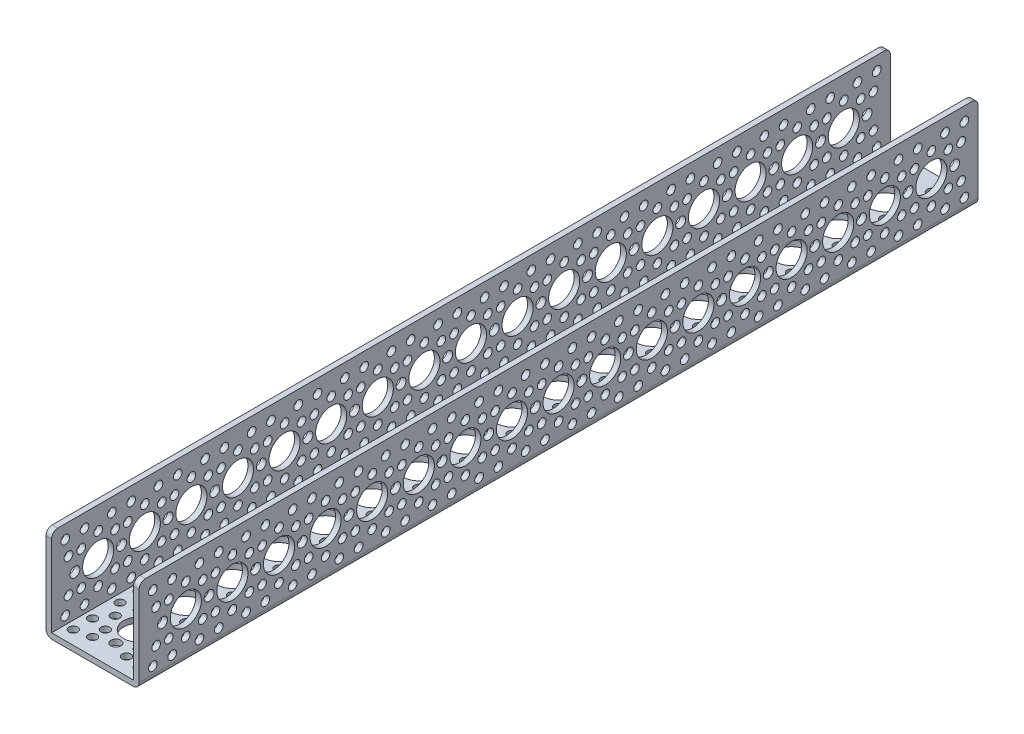
from build123d import *

# Parameters (mm, degrees)
SKETCH1_W                 = 38.1
SKETCH1_H                 = 342.9
BOSS_EXTRUDE1_DEPTH       = 38.1
SKETCH2_W                 = 33.528
SKETCH2_H                 = 35.814
CUT_EXTRUDE1_DEPTH        = 348.107519365
HOLE1_D                   = 12.7254
HOLE1_DEPTH               = 2.286
F_5_CLEARANCE_HOLE1_D     = 3.556
F_5_CLEARANCE_HOLE1_DEPTH = 2.286
F_6_CLEARANCE_HOLE1_D     = 4.064
F_6_CLEARANCE_HOLE1_DEPTH = 2.286
HOLE2_D                   = 12.7254
HOLE2_DEPTH               = 38.1
F_6_CLEARANCE_HOLE2_D     = 4.064
F_6_CLEARANCE_HOLE2_DEPTH = 38.1
F_5_CLEARANCE_HOLE2_D     = 3.556
F_5_CLEARANCE_HOLE2_DEPTH = 38.1
HOLE3_D                   = 12.7254
HOLE3_DEPTH               = 38.1
F_5_CLEARANCE_HOLE3_D     = 3.556
F_5_CLEARANCE_HOLE3_DEPTH = 38.1
F_6_CLEARANCE_HOLE3_D     = 4.064
F_6_CLEARANCE_HOLE3_DEPTH = 38.1
FILLET1_R                 = 2.54


with BuildPart() as part:
    # Sketch1 → Boss-Extrude1 (new body)
    with BuildSketch(Plane.XZ):
        with Locations((19.05, 171.45)):
            Rectangle(SKETCH1_W, SKETCH1_H)
    extrude(amount=-BOSS_EXTRUDE1_DEPTH)

    # Sketch2 → Cut-Extrude1 (cut, through all)
    with BuildSketch(Plane.XY.offset(342.9)):
        with Locations((19.05, 20.193)):
            Rectangle(SKETCH2_W, SKETCH2_H)
    extrude(amount=-CUT_EXTRUDE1_DEPTH, mode=Mode.SUBTRACT)

    # Hole1
    with Locations(Plane(origin=(38.1, 0, 0), x_dir=(0, 0, -1), z_dir=(1, 0, 0))):
        with Locations((-38.1, 19.05), (-19.05, 19.05), (-57.15, 19.05), (-76.2, 19.05), (-95.25, 19.05), (-114.3, 19.05), (-133.35, 19.05), (-152.4, 19.05), (-171.45, 19.05), (-190.5, 19.05), (-209.55, 19.05), (-228.6, 19.05), (-247.65, 19.05), (-266.7, 19.05), (-285.75, 19.05), (-304.8, 19.05), (-323.85, 19.05)):
            Hole(HOLE1_D / 2, depth=HOLE1_DEPTH)

    # #5 Clearance Hole1
    with Locations(Plane(origin=(38.1, 0, 0), x_dir=(0, 0, -1), z_dir=(1, 0, 0))):
        with Locations((-329.429615818, 5.579615818), (-335.985202787, 12.135202787), (-329.429615818, 32.520384182), (-335.985202787, 25.964797213), (-13.470384182, 5.579615818), (-6.914797213, 12.135202787), (-13.470384182, 32.520384182), (-6.914797213, 25.964797213), (-310.379615818, 5.579615818), (-291.329615818, 5.579615818), (-272.279615818, 5.579615818), (-253.229615818, 5.579615818), (-234.179615818, 5.579615818), (-215.129615818, 5.579615818), (-196.079615818, 5.579615818), (-177.029615818, 5.579615818), (-157.979615818, 5.579615818), (-138.929615818, 5.579615818), (-119.879615818, 5.579615818), (-100.829615818, 5.579615818), (-81.779615818, 5.579615818), (-62.729615818, 5.579615818), (-43.679615818, 5.579615818), (-24.629615818, 5.579615818), (-310.379615818, 32.520384182), (-291.329615818, 32.520384182), (-272.279615818, 32.520384182), (-253.229615818, 32.520384182), (-234.179615818, 32.520384182), (-215.129615818, 32.520384182), (-196.079615818, 32.520384182), (-177.029615818, 32.520384182), (-157.979615818, 32.520384182), (-138.929615818, 32.520384182), (-119.879615818, 32.520384182), (-100.829615818, 32.520384182), (-81.779615818, 32.520384182), (-62.729615818, 32.520384182), (-43.679615818, 32.520384182), (-24.629615818, 32.520384182), (-337.320384182, 5.579615818), (-337.320384182, 32.520384182), (-318.270384182, 5.579615818), (-318.270384182, 32.520384182), (-299.220384182, 5.579615818), (-299.220384182, 32.520384182), (-280.170384182, 5.579615818), (-280.170384182, 32.520384182), (-261.120384182, 5.579615818), (-261.120384182, 32.520384182), (-242.070384182, 5.579615818), (-242.070384182, 32.520384182), (-223.020384182, 5.579615818), (-223.020384182, 32.520384182), (-203.970384182, 5.579615818), (-203.970384182, 32.520384182), (-184.920384182, 5.579615818), (-184.920384182, 32.520384182), (-165.870384182, 5.579615818), (-165.870384182, 32.520384182), (-146.820384182, 5.579615818), (-146.820384182, 32.520384182), (-127.770384182, 5.579615818), (-127.770384182, 32.520384182), (-108.720384182, 5.579615818), (-108.720384182, 32.520384182), (-89.670384182, 5.579615818), (-89.670384182, 32.520384182), (-70.620384182, 5.579615818), (-70.620384182, 32.520384182), (-51.570384182, 5.579615818), (-51.570384182, 32.520384182), (-316.935202787, 12.135202787), (-323.85, 9.271), (-330.764797213, 12.135202787), (-330.764797213, 25.964797213), (-323.85, 28.829), (-297.885202787, 12.135202787), (-304.8, 9.271), (-311.714797213, 12.135202787), (-311.714797213, 25.964797213), (-304.8, 28.829), (-278.835202787, 12.135202787), (-285.75, 9.271), (-292.664797213, 12.135202787), (-292.664797213, 25.964797213), (-285.75, 28.829), (-259.785202787, 12.135202787), (-266.7, 9.271), (-273.614797213, 12.135202787), (-273.614797213, 25.964797213), (-266.7, 28.829), (-240.735202787, 12.135202787), (-247.65, 9.271), (-254.564797213, 12.135202787), (-254.564797213, 25.964797213), (-247.65, 28.829), (-221.685202787, 12.135202787), (-228.6, 9.271), (-235.514797213, 12.135202787), (-235.514797213, 25.964797213), (-228.6, 28.829), (-202.635202787, 12.135202787), (-209.55, 9.271), (-216.464797213, 12.135202787), (-216.464797213, 25.964797213), (-209.55, 28.829), (-183.585202787, 12.135202787), (-190.5, 9.271), (-197.414797213, 12.135202787), (-197.414797213, 25.964797213), (-190.5, 28.829), (-164.535202787, 12.135202787), (-171.45, 9.271), (-178.364797213, 12.135202787), (-178.364797213, 25.964797213), (-171.45, 28.829), (-145.485202787, 12.135202787), (-152.4, 9.271), (-159.314797213, 12.135202787), (-159.314797213, 25.964797213), (-152.4, 28.829), (-126.435202787, 12.135202787), (-133.35, 9.271), (-140.264797213, 12.135202787), (-140.264797213, 25.964797213), (-133.35, 28.829), (-107.385202787, 12.135202787), (-114.3, 9.271), (-121.214797213, 12.135202787), (-121.214797213, 25.964797213), (-114.3, 28.829), (-88.335202787, 12.135202787), (-95.25, 9.271), (-102.164797213, 12.135202787), (-102.164797213, 25.964797213), (-95.25, 28.829), (-69.285202787, 12.135202787), (-76.2, 9.271), (-83.114797213, 12.135202787), (-83.114797213, 25.964797213), (-76.2, 28.829), (-50.235202787, 12.135202787), (-57.15, 9.271), (-64.064797213, 12.135202787), (-64.064797213, 25.964797213), (-57.15, 28.829), (-31.185202787, 12.135202787), (-38.1, 9.271), (-45.014797213, 12.135202787), (-45.014797213, 25.964797213), (-38.1, 28.829), (-316.935202787, 25.964797213), (-297.885202787, 25.964797213), (-278.835202787, 25.964797213), (-259.785202787, 25.964797213), (-240.735202787, 25.964797213), (-221.685202787, 25.964797213), (-202.635202787, 25.964797213), (-183.585202787, 25.964797213), (-164.535202787, 25.964797213), (-145.485202787, 25.964797213), (-126.435202787, 25.964797213), (-107.385202787, 25.964797213), (-88.335202787, 25.964797213), (-69.285202787, 25.964797213), (-50.235202787, 25.964797213), (-31.185202787, 25.964797213), (-32.520384182, 5.579615818), (-32.520384182, 32.520384182), (-5.579615818, 5.579615818), (-5.579615818, 32.520384182), (-12.135202787, 12.135202787), (-19.05, 9.271), (-25.964797213, 12.135202787), (-25.964797213, 25.964797213), (-19.05, 28.829), (-12.135202787, 25.964797213)):
            Hole(F_5_CLEARANCE_HOLE1_D / 2, depth=F_5_CLEARANCE_HOLE1_DEPTH)

    # #6 Clearance Hole1
    with Locations(Plane(origin=(38.1, 0, 0), x_dir=(0, 0, -1), z_dir=(1, 0, 0))):
        with Locations((-333.375, 19.05), (-314.325, 19.05), (-295.275, 19.05), (-276.225, 19.05), (-257.175, 19.05), (-238.125, 19.05), (-219.075, 19.05), (-200.025, 19.05), (-180.975, 19.05), (-161.925, 19.05), (-142.875, 19.05), (-123.825, 19.05), (-104.775, 19.05), (-85.725, 19.05), (-66.675, 19.05), (-47.625, 19.05), (-28.575, 19.05), (-9.525, 19.05)):
            Hole(F_6_CLEARANCE_HOLE1_D / 2, depth=F_6_CLEARANCE_HOLE1_DEPTH)

    # Hole2
    with Locations(Plane(origin=(0, 0, 0), x_dir=(-1, 0, 0), z_dir=(0, -1, 0))):
        with Locations((-19.05, -323.85), (-19.05, -304.8), (-19.05, -285.75), (-19.05, -266.7), (-19.05, -247.65), (-19.05, -228.6), (-19.05, -209.55), (-19.05, -190.5), (-19.05, -171.45), (-19.05, -152.4), (-19.05, -133.35), (-19.05, -114.3), (-19.05, -95.25), (-19.05, -76.2), (-19.05, -57.15), (-19.05, -38.1), (-19.05, -19.05)):
            Hole(HOLE2_D / 2, depth=HOLE2_DEPTH)

    # #6 Clearance Hole2
    with Locations(Plane(origin=(0, 0, 0), x_dir=(-1, 0, 0), z_dir=(0, -1, 0))):
        with Locations((-19.05, -333.375), (-19.05, -314.325), (-19.05, -295.275), (-19.05, -276.225), (-19.05, -257.175), (-19.05, -238.125), (-19.05, -219.075), (-19.05, -200.025), (-19.05, -180.975), (-19.05, -161.925), (-19.05, -142.875), (-19.05, -123.825), (-19.05, -104.775), (-19.05, -85.725), (-19.05, -66.675), (-19.05, -47.625), (-19.05, -28.575), (-19.05, -9.525)):
            Hole(F_6_CLEARANCE_HOLE2_D / 2, depth=F_6_CLEARANCE_HOLE2_DEPTH)

    # #5 Clearance Hole2
    with Locations(Plane(origin=(0, 0, 0), x_dir=(-1, 0, 0), z_dir=(0, -1, 0))):
        with Locations((-5.579615818, -337.320384182), (-5.579615818, -329.429615818), (-12.135202787, -335.985202787), (-32.520384182, -337.320384182), (-32.520384182, -329.429615818), (-25.964797213, -335.985202787), (-5.579615818, -318.270384182), (-5.579615818, -310.379615818), (-32.520384182, -318.270384182), (-32.520384182, -310.379615818), (-5.579615818, -299.220384182), (-5.579615818, -291.329615818), (-32.520384182, -299.220384182), (-32.520384182, -291.329615818), (-5.579615818, -280.170384182), (-5.579615818, -272.279615818), (-32.520384182, -280.170384182), (-32.520384182, -272.279615818), (-5.579615818, -261.120384182), (-5.579615818, -253.229615818), (-32.520384182, -261.120384182), (-32.520384182, -253.229615818), (-5.579615818, -242.070384182), (-5.579615818, -234.179615818), (-32.520384182, -242.070384182), (-32.520384182, -234.179615818), (-5.579615818, -223.020384182), (-5.579615818, -215.129615818), (-32.520384182, -223.020384182), (-32.520384182, -215.129615818), (-5.579615818, -203.970384182), (-5.579615818, -196.079615818), (-32.520384182, -203.970384182), (-32.520384182, -196.079615818), (-5.579615818, -184.920384182), (-5.579615818, -177.029615818), (-32.520384182, -184.920384182), (-32.520384182, -177.029615818), (-5.579615818, -165.870384182), (-5.579615818, -157.979615818), (-32.520384182, -165.870384182), (-32.520384182, -157.979615818), (-5.579615818, -146.820384182), (-5.579615818, -138.929615818), (-32.520384182, -146.820384182), (-32.520384182, -138.929615818), (-5.579615818, -127.770384182), (-5.579615818, -119.879615818), (-32.520384182, -127.770384182), (-32.520384182, -119.879615818), (-5.579615818, -108.720384182), (-5.579615818, -100.829615818), (-32.520384182, -108.720384182), (-32.520384182, -100.829615818), (-5.579615818, -89.670384182), (-5.579615818, -81.779615818), (-32.520384182, -89.670384182), (-32.520384182, -81.779615818), (-5.579615818, -70.620384182), (-5.579615818, -62.729615818), (-32.520384182, -70.620384182), (-32.520384182, -62.729615818), (-5.579615818, -51.570384182), (-5.579615818, -43.679615818), (-32.520384182, -51.570384182), (-32.520384182, -43.679615818), (-12.135202787, -316.935202787), (-9.271, -323.85), (-12.135202787, -330.764797213), (-25.964797213, -330.764797213), (-28.829, -323.85), (-25.964797213, -316.935202787), (-12.135202787, -297.885202787), (-9.271, -304.8), (-12.135202787, -311.714797213), (-25.964797213, -311.714797213), (-28.829, -304.8), (-25.964797213, -297.885202787), (-12.135202787, -278.835202787), (-9.271, -285.75), (-12.135202787, -292.664797213), (-25.964797213, -292.664797213), (-28.829, -285.75), (-25.964797213, -278.835202787), (-12.135202787, -259.785202787), (-9.271, -266.7), (-12.135202787, -273.614797213), (-25.964797213, -273.614797213), (-28.829, -266.7), (-25.964797213, -259.785202787), (-12.135202787, -240.735202787), (-9.271, -247.65), (-12.135202787, -254.564797213), (-25.964797213, -254.564797213), (-28.829, -247.65), (-25.964797213, -240.735202787), (-12.135202787, -221.685202787), (-9.271, -228.6), (-12.135202787, -235.514797213), (-25.964797213, -235.514797213), (-28.829, -228.6), (-25.964797213, -221.685202787), (-12.135202787, -202.635202787), (-9.271, -209.55), (-12.135202787, -216.464797213), (-25.964797213, -216.464797213), (-28.829, -209.55), (-25.964797213, -202.635202787), (-12.135202787, -183.585202787), (-9.271, -190.5), (-12.135202787, -197.414797213), (-25.964797213, -197.414797213), (-28.829, -190.5), (-25.964797213, -183.585202787), (-12.135202787, -164.535202787), (-9.271, -171.45), (-12.135202787, -178.364797213), (-25.964797213, -178.364797213), (-28.829, -171.45), (-25.964797213, -164.535202787), (-12.135202787, -145.485202787), (-9.271, -152.4), (-12.135202787, -159.314797213), (-25.964797213, -159.314797213), (-28.829, -152.4), (-25.964797213, -145.485202787), (-12.135202787, -126.435202787), (-9.271, -133.35), (-12.135202787, -140.264797213), (-25.964797213, -140.264797213), (-28.829, -133.35), (-25.964797213, -126.435202787), (-12.135202787, -107.385202787), (-9.271, -114.3), (-12.135202787, -121.214797213), (-25.964797213, -121.214797213), (-28.829, -114.3), (-25.964797213, -107.385202787), (-12.135202787, -88.335202787), (-9.271, -95.25), (-12.135202787, -102.164797213), (-25.964797213, -102.164797213), (-28.829, -95.25), (-25.964797213, -88.335202787), (-12.135202787, -69.285202787), (-9.271, -76.2), (-12.135202787, -83.114797213), (-25.964797213, -83.114797213), (-28.829, -76.2), (-25.964797213, -69.285202787), (-12.135202787, -50.235202787), (-9.271, -57.15), (-12.135202787, -64.064797213), (-25.964797213, -64.064797213), (-28.829, -57.15), (-25.964797213, -50.235202787), (-9.271, -38.1), (-12.135202787, -45.014797213), (-25.964797213, -45.014797213), (-28.829, -38.1), (-5.579615818, -32.520384182), (-5.579615818, -24.629615818), (-12.135202787, -31.185202787), (-32.520384182, -32.520384182), (-32.520384182, -24.629615818), (-25.964797213, -31.185202787), (-5.579615818, -5.579615818), (-5.579615818, -13.470384182), (-12.135202787, -6.914797213), (-32.520384182, -5.579615818), (-32.520384182, -13.470384182), (-25.964797213, -6.914797213), (-12.135202787, -12.135202787), (-9.271, -19.05), (-12.135202787, -25.964797213), (-25.964797213, -25.964797213), (-28.829, -19.05), (-25.964797213, -12.135202787)):
            Hole(F_5_CLEARANCE_HOLE2_D / 2, depth=F_5_CLEARANCE_HOLE2_DEPTH)

    # Hole3
    with Locations(Plane.ZY):
        with Locations((38.1, 19.05), (19.05, 19.05), (57.15, 19.05), (76.2, 19.05), (95.25, 19.05), (114.3, 19.05), (133.35, 19.05), (152.4, 19.05), (171.45, 19.05), (190.5, 19.05), (209.55, 19.05), (228.6, 19.05), (247.65, 19.05), (266.7, 19.05), (285.75, 19.05), (304.8, 19.05), (323.85, 19.05)):
            Hole(HOLE3_D / 2, depth=HOLE3_DEPTH)

    # #5 Clearance Hole3
    with Locations(Plane.ZY):
        with Locations((329.429615818, 5.579615818), (335.985202787, 12.135202787), (329.429615818, 32.520384182), (335.985202787, 25.964797213), (13.470384182, 5.579615818), (6.914797213, 12.135202787), (13.470384182, 32.520384182), (6.914797213, 25.964797213), (310.379615818, 5.579615818), (291.329615818, 5.579615818), (272.279615818, 5.579615818), (253.229615818, 5.579615818), (234.179615818, 5.579615818), (215.129615818, 5.579615818), (196.079615818, 5.579615818), (177.029615818, 5.579615818), (157.979615818, 5.579615818), (138.929615818, 5.579615818), (119.879615818, 5.579615818), (100.829615818, 5.579615818), (81.779615818, 5.579615818), (62.729615818, 5.579615818), (43.679615818, 5.579615818), (24.629615818, 5.579615818), (310.379615818, 32.520384182), (291.329615818, 32.520384182), (272.279615818, 32.520384182), (253.229615818, 32.520384182), (234.179615818, 32.520384182), (215.129615818, 32.520384182), (196.079615818, 32.520384182), (177.029615818, 32.520384182), (157.979615818, 32.520384182), (138.929615818, 32.520384182), (119.879615818, 32.520384182), (100.829615818, 32.520384182), (81.779615818, 32.520384182), (62.729615818, 32.520384182), (43.679615818, 32.520384182), (24.629615818, 32.520384182), (337.320384182, 5.579615818), (337.320384182, 32.520384182), (318.270384182, 5.579615818), (318.270384182, 32.520384182), (299.220384182, 5.579615818), (299.220384182, 32.520384182), (280.170384182, 5.579615818), (280.170384182, 32.520384182), (261.120384182, 5.579615818), (261.120384182, 32.520384182), (242.070384182, 5.579615818), (242.070384182, 32.520384182), (223.020384182, 5.579615818), (223.020384182, 32.520384182), (203.970384182, 5.579615818), (203.970384182, 32.520384182), (184.920384182, 5.579615818), (184.920384182, 32.520384182), (165.870384182, 5.579615818), (165.870384182, 32.520384182), (146.820384182, 5.579615818), (146.820384182, 32.520384182), (127.770384182, 5.579615818), (127.770384182, 32.520384182), (108.720384182, 5.579615818), (108.720384182, 32.520384182), (89.670384182, 5.579615818), (89.670384182, 32.520384182), (70.620384182, 5.579615818), (70.620384182, 32.520384182), (51.570384182, 5.579615818), (51.570384182, 32.520384182), (316.935202787, 12.135202787), (323.85, 9.271), (330.764797213, 12.135202787), (330.764797213, 25.964797213), (323.85, 28.829), (297.885202787, 12.135202787), (304.8, 9.271), (311.714797213, 12.135202787), (311.714797213, 25.964797213), (304.8, 28.829), (278.835202787, 12.135202787), (285.75, 9.271), (292.664797213, 12.135202787), (292.664797213, 25.964797213), (285.75, 28.829), (259.785202787, 12.135202787), (266.7, 9.271), (273.614797213, 12.135202787), (273.614797213, 25.964797213), (266.7, 28.829), (240.735202787, 12.135202787), (247.65, 9.271), (254.564797213, 12.135202787), (254.564797213, 25.964797213), (247.65, 28.829), (221.685202787, 12.135202787), (228.6, 9.271), (235.514797213, 12.135202787), (235.514797213, 25.964797213), (228.6, 28.829), (202.635202787, 12.135202787), (209.55, 9.271), (216.464797213, 12.135202787), (216.464797213, 25.964797213), (209.55, 28.829), (183.585202787, 12.135202787), (190.5, 9.271), (197.414797213, 12.135202787), (197.414797213, 25.964797213), (190.5, 28.829), (164.535202787, 12.135202787), (171.45, 9.271), (178.364797213, 12.135202787), (178.364797213, 25.964797213), (171.45, 28.829), (145.485202787, 12.135202787), (152.4, 9.271), (159.314797213, 12.135202787), (159.314797213, 25.964797213), (152.4, 28.829), (126.435202787, 12.135202787), (133.35, 9.271), (140.264797213, 12.135202787), (140.264797213, 25.964797213), (133.35, 28.829), (107.385202787, 12.135202787), (114.3, 9.271), (121.214797213, 12.135202787), (121.214797213, 25.964797213), (114.3, 28.829), (88.335202787, 12.135202787), (95.25, 9.271), (102.164797213, 12.135202787), (102.164797213, 25.964797213), (95.25, 28.829), (69.285202787, 12.135202787), (76.2, 9.271), (83.114797213, 12.135202787), (83.114797213, 25.964797213), (76.2, 28.829), (50.235202787, 12.135202787), (57.15, 9.271), (64.064797213, 12.135202787), (64.064797213, 25.964797213), (57.15, 28.829), (31.185202787, 12.135202787), (38.1, 9.271), (45.014797213, 12.135202787), (45.014797213, 25.964797213), (38.1, 28.829), (316.935202787, 25.964797213), (297.885202787, 25.964797213), (278.835202787, 25.964797213), (259.785202787, 25.964797213), (240.735202787, 25.964797213), (221.685202787, 25.964797213), (202.635202787, 25.964797213), (183.585202787, 25.964797213), (164.535202787, 25.964797213), (145.485202787, 25.964797213), (126.435202787, 25.964797213), (107.385202787, 25.964797213), (88.335202787, 25.964797213), (69.285202787, 25.964797213), (50.235202787, 25.964797213), (31.185202787, 25.964797213), (32.520384182, 5.579615818), (32.520384182, 32.520384182), (5.579615818, 5.579615818), (5.579615818, 32.520384182), (12.135202787, 12.135202787), (19.05, 9.271), (25.964797213, 12.135202787), (25.964797213, 25.964797213), (19.05, 28.829), (12.135202787, 25.964797213)):
            Hole(F_5_CLEARANCE_HOLE3_D / 2, depth=F_5_CLEARANCE_HOLE3_DEPTH)

    # #6 Clearance Hole3
    with Locations(Plane.ZY):
        with Locations((333.375, 19.05), (314.325, 19.05), (295.275, 19.05), (276.225, 19.05), (257.175, 19.05), (238.125, 19.05), (219.075, 19.05), (200.025, 19.05), (180.975, 19.05), (161.925, 19.05), (142.875, 19.05), (123.825, 19.05), (104.775, 19.05), (85.725, 19.05), (66.675, 19.05), (47.625, 19.05), (28.575, 19.05), (9.525, 19.05)):
            Hole(F_6_CLEARANCE_HOLE3_D / 2, depth=F_6_CLEARANCE_HOLE3_DEPTH)

    # Fillet1
    fillet1_edges = [part.edges().sort_by_distance(p)[0] for p in [
        (1.143, 38.1, 342.9),
        (36.957, 38.1, 342.9),
        (36.957, 38.1, 0),
        (38.1, 0, 171.45),
        (1.143, 38.1, 0),
        (0, 0, 171.45),
    ]]
    fillet(fillet1_edges, radius=FILLET1_R)


solid = part.part
